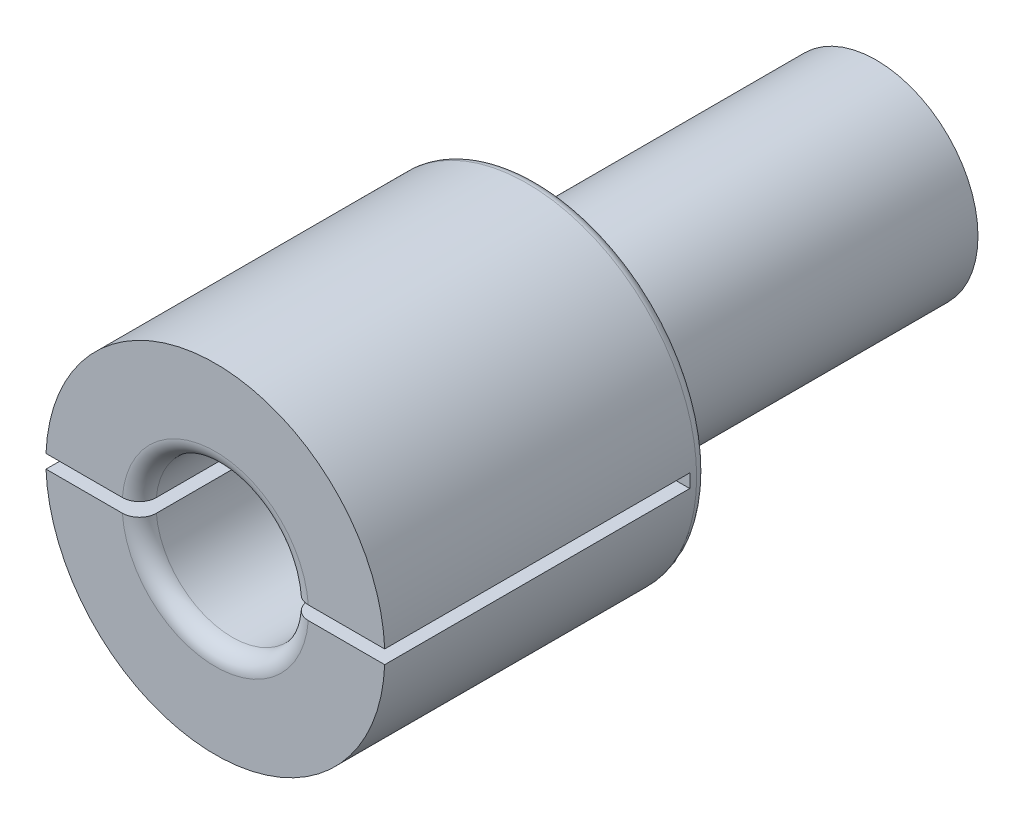
from build123d import *

# Parameters (mm, degrees)
ESBO_O1_R                = 5
RESSALTO_EXTRUS_O1_DEPTH = 9.5
ESBO_O2_R                = 2.25
CORTE_EXTRUS_O1_DEPTH    = 11
ESBO_O3_R                = 3
RESSALTO_EXTRUS_O2_DEPTH = 10
CORTE_EXTRUS_O2_DEPTH    = 9
FILETE1_R                = 0.5
FILETE2_R                = 0.3
CHANFRO1_SIZE            = 1


with BuildPart() as part:
    # Esboço1 → Ressalto-extrusão1 (new body)
    with BuildSketch(Plane.XY):
        with Locations((-26.183327478, 4.383756345)):
            Circle(ESBO_O1_R)
    extrude(amount=RESSALTO_EXTRUS_O1_DEPTH)

    # Esboço2 → Corte-extrusão1 (cut)
    with BuildSketch(Plane.XY.offset(9.5)):
        with Locations((-26.183327478, 4.383756345)):
            Circle(ESBO_O2_R)
    extrude(amount=-CORTE_EXTRUS_O1_DEPTH, mode=Mode.SUBTRACT)

    # Esboço3 → Ressalto-extrusão2 (add)
    with BuildSketch(Plane(origin=(0, 0, 0), x_dir=(-1, 0, 0), z_dir=(0, 0, -1))):
        with Locations(Location((26.183327478, 4.383756345, 0), (0, 0, 180))):
            Circle(ESBO_O3_R)
    extrude(amount=RESSALTO_EXTRUS_O2_DEPTH)

    # Esboço4 → Corte-extrusão2 (cut)
    with BuildSketch(Plane.XY.offset(9.5)):
        with BuildLine():
            Line((-31.183327478, 4.583756345), (-21.183327478, 4.583756345))
            ThreePointArc((-21.183327478, 4.583756345), (-20.983327478, 4.383756345), (-21.183327478, 4.183756345))
            Line((-21.183327478, 4.183756345), (-31.183327478, 4.183756345))
            ThreePointArc((-31.183327478, 4.183756345), (-31.383327478, 4.383756345), (-31.183327478, 4.583756345))
        make_face()
    extrude(amount=-CORTE_EXTRUS_O2_DEPTH, mode=Mode.SUBTRACT)

    # Filete1
    filete1_edges = [part.edges().sort_by_distance(p)[0] for p in [
        (-26.183327478, 2.133756345, 9.5),
        (-26.183327478, 6.633756345, 9.5),
    ]]
    fillet(filete1_edges, radius=FILETE1_R)

    # Filete2
    filete2_edges = [part.edges().sort_by_distance(p)[0] for p in [
        (-31.183327478, 4.383756345, 0),
    ]]
    fillet(filete2_edges, radius=FILETE2_R)

    # Chanfro1
    # the kernel refuses this chamfer: 1 mm, written as the material it adds along each edge
    with BuildSketch(Plane(origin=(-26.183327478, 4.383756345, 0), x_dir=(1, 0, 0), z_dir=(0, -1, 0))) as chanfro1_piece_1_section:
        Polygon((2.25, CHANFRO1_SIZE), (2.25 - CHANFRO1_SIZE, 0), (2.25, 0), align=None)
    chanfro1_piece_1 = revolve(axis=Axis((-26.183327478, 4.383756345, 0), (0, 0, 1)), mode=Mode.PRIVATE)
    chanfro1_piece_1 = split(chanfro1_piece_1, bisect_by=Plane(origin=(-24.32601133, 4.383756345, 0.5), z_dir=(0, 0, -1)), keep=Keep.TOP, mode=Mode.PRIVATE)
    add(chanfro1_piece_1)
    with BuildSketch(Plane(origin=(-26.183327478, 4.383756345, 0), x_dir=(1, 0, 0), z_dir=(0, -1, 0))) as chanfro1_piece_2_section:
        Polygon((2.25, CHANFRO1_SIZE), (2.25 - CHANFRO1_SIZE, 0), (2.25, 0), align=None)
    chanfro1_piece_2 = revolve(axis=Axis((-26.183327478, 4.383756345, 0), (0, 0, 1)), mode=Mode.PRIVATE)
    chanfro1_piece_2 = split(chanfro1_piece_2, bisect_by=Plane(origin=(-26.183327478, 4.583756345, 0.743524391), z_dir=(0, 1, 0)), keep=Keep.TOP, mode=Mode.PRIVATE)
    add(chanfro1_piece_2)
    with BuildSketch(Plane(origin=(-26.183327478, 4.383756345, 0), x_dir=(1, 0, 0), z_dir=(0, -1, 0))) as chanfro1_piece_3_section:
        Polygon((2.25, CHANFRO1_SIZE), (2.25 - CHANFRO1_SIZE, 0), (2.25, 0), align=None)
    chanfro1_piece_3 = revolve(axis=Axis((-26.183327478, 4.383756345, 0), (0, 0, 1)), mode=Mode.PRIVATE)
    chanfro1_piece_3 = split(chanfro1_piece_3, bisect_by=Plane(origin=(-26.183327478, 4.183756345, 0.743524391), z_dir=(0, -1, 0)), keep=Keep.TOP, mode=Mode.PRIVATE)
    add(chanfro1_piece_3)


solid = part.part
